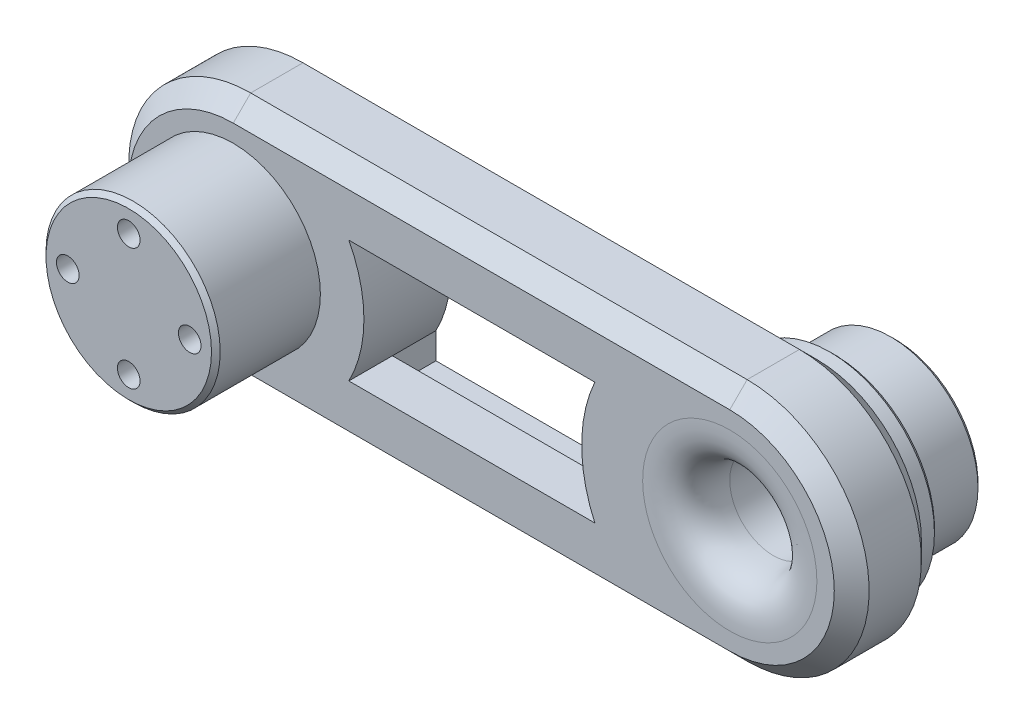
from build123d import *

# Parameters (mm, degrees)
EXTRUDE_1_DEPTH     = 10
SKETCH_2_R          = 10
EXTRUDE_2_DEPTH     = 12
SKETCH_3_R          = 10
EXTRUDE_3_DEPTH     = 9
SKETCH_4_R          = 12
SKETCH_4_R_2        = 10
EXTRUDE_4_DEPTH     = 2
CHAMFER_1_SIZE      = 0.5
CHAMFER_2_SIZE      = 2
SKETCH_5_R          = 2
CUT_EXTRUDE_1_DEPTH = 6
SKETCH_6_R          = 1.3
CUT_EXTRUDE_2_DEPTH = 6
CUT_EXTRUDE_3_REACH = 76.82
SKETCH_8_W          = 28.241567454
SKETCH_8_H          = 3
CUT_EXTRUDE_4_DEPTH = 5
SKETCH_9_R          = 5
CUT_EXTRUDE_5_DEPTH = 10
SKETCH_10_R         = 5
CUT_EXTRUDE_6_DEPTH = 10
FILLET_1_SIZE       = 5


# Some blends are built 0.0001 mm under size
with BuildPart() as part:
    # 草图1 → 凸台-拉伸1 (new body)
    with BuildSketch(Plane.XY):
        with BuildLine():
            Line((57, 14), (0, 14))
            ThreePointArc((0, 14), (-14, 0), (0, -14))
            Line((0, -14), (57, -14))
            ThreePointArc((57, -14), (71, 0), (57, 14))
        make_face()
    extrude(amount=EXTRUDE_1_DEPTH)

    # 草图2 → 凸台-拉伸2 (add)
    with BuildSketch(Plane.XY.offset(10)):
        Circle(SKETCH_2_R)
    extrude(amount=EXTRUDE_2_DEPTH)

    # 草图3 → 凸台-拉伸3 (add)
    with BuildSketch(Plane(origin=(0, 0, 0), x_dir=(-1, 0, 0), z_dir=(0, 0, -1))):
        with Locations((-57, 0)):
            Circle(SKETCH_3_R)
    extrude(amount=EXTRUDE_3_DEPTH)

    # 草图4 → 凸台-拉伸4 (add)
    with BuildSketch(Plane(origin=(0, 0, 0), x_dir=(-1, 0, 0), z_dir=(0, 0, -1))):
        with Locations(Location((-57, 0, 0), (0, 0, 180))):
            Circle(SKETCH_4_R)
        with Locations((-57, 0)):
            Circle(SKETCH_4_R_2, mode=Mode.SUBTRACT)
    extrude(amount=EXTRUDE_4_DEPTH)

    # 倒角1
    chamfer_1_edges = [part.edges().sort_by_distance(p)[0] for p in [
        (-10, 0, 22),
        (67, 0, -9),
        (45, 0, -2),
    ]]
    chamfer(chamfer_1_edges, length=CHAMFER_1_SIZE)

    # 倒角2
    chamfer_2_edges = [part.edges().sort_by_distance(p)[0] for p in [
        (71, 0, 10),
        (28.5, 14, 10),
        (-14, 0, 10),
        (28.5, -14, 10),
        (-14, 0, 0),
        (28.5, 14, 0),
        (71, 0, 0),
        (28.5, -14, 0),
    ]]
    chamfer(chamfer_2_edges, length=CHAMFER_2_SIZE - 0.0001)  # a hair under: the kernel refuses the full size

    # 草图5 → 切除-拉伸1 (cut)
    with BuildSketch(Plane(origin=(0, 0, -9), x_dir=(-1, 0, 0), z_dir=(0, 0, -1))):
        with Locations((-57, 5)):
            Circle(SKETCH_5_R)
        with Locations((-52.669872981, -2.5)):
            Circle(SKETCH_5_R)
        with Locations((-61.330127019, -2.5)):
            Circle(SKETCH_5_R)
    extrude(amount=-CUT_EXTRUDE_1_DEPTH, mode=Mode.SUBTRACT)

    # 草图6 → 切除-拉伸2 (cut)
    with BuildSketch(Plane.XY.offset(22)):
        with Locations((0, 7)):
            Circle(SKETCH_6_R)
        with Locations((7, 0)):
            Circle(SKETCH_6_R)
        with Locations((0, -7)):
            Circle(SKETCH_6_R)
        with Locations((-7, 0)):
            Circle(SKETCH_6_R)
    extrude(amount=-CUT_EXTRUDE_2_DEPTH, mode=Mode.SUBTRACT)

    # 草图7 → 切除-拉伸3 (cut, up to next)
    with BuildSketch(Plane.XY.offset(10), mode=Mode.PRIVATE) as cut_extrude_3_sk1:
        with BuildLine():
            ThreePointArc((41.508066615, -7), (40, 0), (41.508066615, 7))
            Line((41.508066615, 7), (13.266499161, 7))
            ThreePointArc((13.266499161, 7), (14.560176637, 3.605725487), (15, 0))
            ThreePointArc((15, 0), (14.560176637, -3.605725487), (13.266499161, -7))
            Line((13.266499161, -7), (41.508066615, -7))
        make_face()
    cut_extrude_3_tool1 = extrude(cut_extrude_3_sk1.sketch, amount=-CUT_EXTRUDE_3_REACH, mode=Mode.PRIVATE) & part.part
    add(cut_extrude_3_tool1.solids().sort_by_distance((27.463612, 0, 10))[0], mode=Mode.SUBTRACT)

    # 草图8 → 切除-拉伸4 (cut)
    with BuildSketch(Plane(origin=(0, 0, 0), x_dir=(-1, 0, 0), z_dir=(0, 0, -1))):
        with Locations((-27.387282888, 8.5)):
            Rectangle(SKETCH_8_W, SKETCH_8_H)
        with Locations((-27.387282888, -8.5)):
            Rectangle(SKETCH_8_W, SKETCH_8_H)
    extrude(amount=-CUT_EXTRUDE_4_DEPTH, mode=Mode.SUBTRACT)

    # 草图9 → 切除-拉伸5 (cut)
    with BuildSketch(Plane.XY.offset(10)):
        with Locations((57, 0)):
            Circle(SKETCH_9_R)
    extrude(amount=-CUT_EXTRUDE_5_DEPTH, mode=Mode.SUBTRACT)

    # 草图10 → 切除-拉伸6 (cut)
    with BuildSketch(Plane(origin=(0, 0, 0), x_dir=(-1, 0, 0), z_dir=(0, 0, -1))):
        Circle(SKETCH_10_R)
    extrude(amount=-CUT_EXTRUDE_6_DEPTH, mode=Mode.SUBTRACT)

    # 圆角1
    # a fillet whose section is not a circle: 5 mm, written as the material it takes off along each edge
    with BuildSketch(Plane(origin=(57, 0, 10), x_dir=(1, 0, 0), z_dir=(0, -1, 0))) as fillet_1_piece_1:
        with BuildLine():
            add(Edge.make_bspline([(5 + FILLET_1_SIZE, 0), (5 + FILLET_1_SIZE * 0.831801948466, 0), (5 + FILLET_1_SIZE * 0.663603896932, 0), (5 + FILLET_1_SIZE * 0.292893218813, -FILLET_1_SIZE * 0.0716919198361), (5 + FILLET_1_SIZE * 0.0716919198361, -FILLET_1_SIZE * 0.292893218813), (5, -FILLET_1_SIZE * 0.663603896932), (5, -FILLET_1_SIZE * 0.831801948466), (5, -FILLET_1_SIZE)], knots=[0, 0, 0, 0, 0, 0, 0.5, 0.5, 1, 1, 1, 1, 1, 1], degree=5))
            Line((5, -FILLET_1_SIZE), (5, 0))
            Line((5, 0), (5 + FILLET_1_SIZE, 0))
        make_face()
    revolve(axis=Axis((57, 0, 10), (0, 0, 1)), mode=Mode.SUBTRACT)
    with BuildSketch(Plane(origin=(0, 0, 0), x_dir=(-1, 0, 0), z_dir=(0, -1, 0))) as fillet_1_piece_2:
        with BuildLine():
            add(Edge.make_bspline([(5 + FILLET_1_SIZE, 0), (5 + FILLET_1_SIZE * 0.831801948466, 0), (5 + FILLET_1_SIZE * 0.663603896932, 0), (5 + FILLET_1_SIZE * 0.292893218813, -FILLET_1_SIZE * 0.0716919198361), (5 + FILLET_1_SIZE * 0.0716919198361, -FILLET_1_SIZE * 0.292893218813), (5, -FILLET_1_SIZE * 0.663603896932), (5, -FILLET_1_SIZE * 0.831801948466), (5, -FILLET_1_SIZE)], knots=[0, 0, 0, 0, 0, 0, 0.5, 0.5, 1, 1, 1, 1, 1, 1], degree=5))
            Line((5, -FILLET_1_SIZE), (5, 0))
            Line((5, 0), (5 + FILLET_1_SIZE, 0))
        make_face()
    revolve(axis=Axis((0, 0, 0), (0, 0, -1)), mode=Mode.SUBTRACT)


solid = part.part
